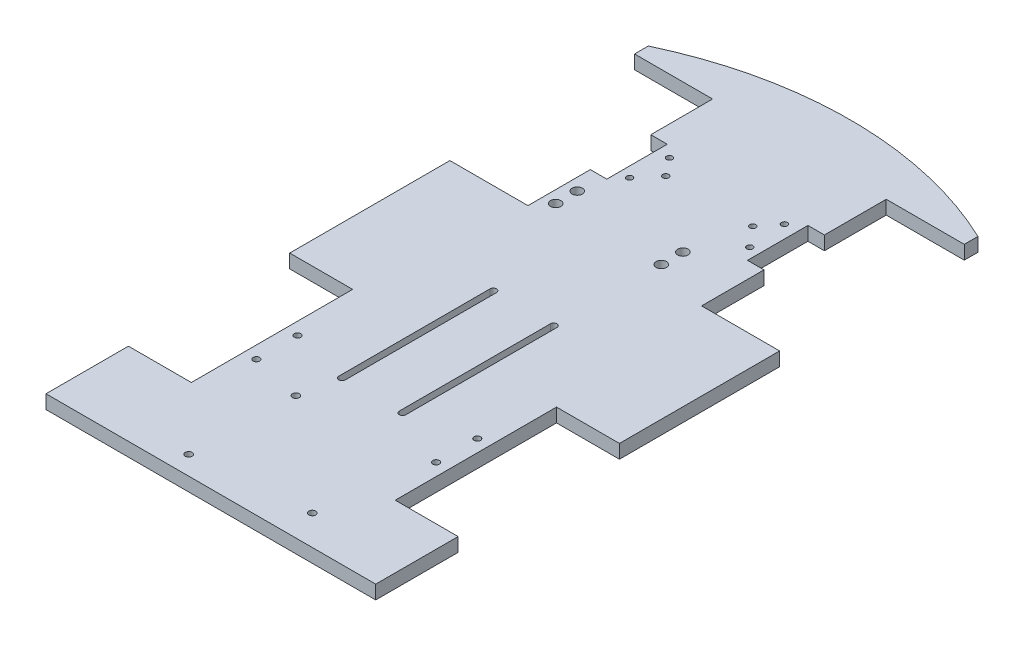
from build123d import *

# Parameters (mm, degrees)
CHASSIS_DEPTH      = 6.35
SKETCH2_R          = 1.5875
SKETCH2_R_2        = 1.3716
SKETCH2_R_3        = 2.38125
SKETCH2_R_4        = 1.5
CUT_EXTRUDE1_DEPTH = 17.78


with BuildPart() as part:
    # Sketch1 → Chassis (new body)
    with BuildSketch(Plane(origin=(0, 0, 0), x_dir=(1, 0, 0), z_dir=(0, 1, 0))):
        with BuildLine():
            ThreePointArc((76.2, 49.022), (39.053241005, 61.832834411), (0, 66.173750115))
            Line((0, 66.173750115), (0, -229.362))
            Line((0, -229.362), (76.2, -229.362))
            Line((76.2, -229.362), (76.2, -191.262))
            Line((76.2, -191.262), (47.117, -191.262))
            Line((47.117, -191.262), (47.117, -116.713))
            Line((47.117, -116.713), (76.2, -116.713))
            Line((76.2, -116.713), (76.2, -42.672))
            Line((76.2, -42.672), (40.132, -42.672))
            Line((40.132, -42.672), (40.132, -13.843))
            Line((40.132, -13.843), (32.512, -13.843))
            Line((32.512, -13.843), (32.512, 14.097))
            Line((32.512, 14.097), (40.132, 14.097))
            Line((40.132, 14.097), (40.132, 42.672))
            Line((40.132, 42.672), (76.2, 42.672))
            Line((76.2, 42.672), (76.2, 49.022))
        make_face()
    chassis = extrude(amount=CHASSIS_DEPTH)

    # Mirror1: Chassis across plane
    add(chassis.mirror(Plane(origin=(0, 6.35, 0), x_dir=(0, 0, 1), z_dir=(1, 0, 0))))

    # Sketch2 → Cut-Extrude1 (cut)
    with BuildSketch(Plane(origin=(0, 0, 0), x_dir=(1, 0, 0), z_dir=(0, 1, 0))):
        with Locations((-17.703140953, -172.359887538)):
            Circle(SKETCH2_R)
        with Locations((-18.973140953, -220.619887538)):
            Circle(SKETCH2_R)
        with Locations((33.096859047, -215.539887538)):
            Circle(SKETCH2_R)
        with Locations((-26.555704526, 9.169971692)):
            Circle(SKETCH2_R_2)
        with Locations((-20.105647723, 0.999384842)):
            Circle(SKETCH2_R_2)
        with Locations((-27.786476371, -8.040568412)):
            Circle(SKETCH2_R_2)
        with Locations((26.555704526, 9.169971692)):
            Circle(SKETCH2_R_2)
        with Locations((20.105647723, 0.999384842)):
            Circle(SKETCH2_R_2)
        with Locations((27.786476371, -8.040568412)):
            Circle(SKETCH2_R_2)
        with Locations((14.2672, -25.46003476)):
            Circle(SKETCH2_R_3)
        with Locations((14.2672, -35.42953476)):
            Circle(SKETCH2_R_3)
        with Locations((-34.5516, -25.46003476)):
            Circle(SKETCH2_R_3)
        with Locations((-34.5516, -35.42953476)):
            Circle(SKETCH2_R_3)
        with Locations((-41.402, -147.875000023)):
            Circle(SKETCH2_R_4)
        with Locations((-41.402, -166.925000023)):
            Circle(SKETCH2_R_4)
        with Locations((41.402, -147.605334461)):
            Circle(SKETCH2_R_4)
        with Locations((41.402, -166.655334461)):
            Circle(SKETCH2_R_4)
        with BuildLine():
            Line((15.367, -84.765888971), (15.367, -154.615888971))
            ThreePointArc((15.367, -154.615888971), (13.867, -156.115888971), (12.367, -154.615888971))
            Line((12.367, -154.615888971), (12.367, -84.765888971))
            ThreePointArc((12.367, -84.765888971), (13.867, -83.265888971), (15.367, -84.765888971))
        make_face()
        with BuildLine():
            Line((-12.573, -84.765888971), (-12.573, -154.615888971))
            ThreePointArc((-12.573, -154.615888971), (-14.073, -156.115888971), (-15.573, -154.615888971))
            Line((-15.573, -154.615888971), (-15.573, -84.765888971))
            ThreePointArc((-15.573, -84.765888971), (-14.073, -83.265888971), (-12.573, -84.765888971))
        make_face()
    extrude(amount=CUT_EXTRUDE1_DEPTH, mode=Mode.SUBTRACT)


solid = part.part
